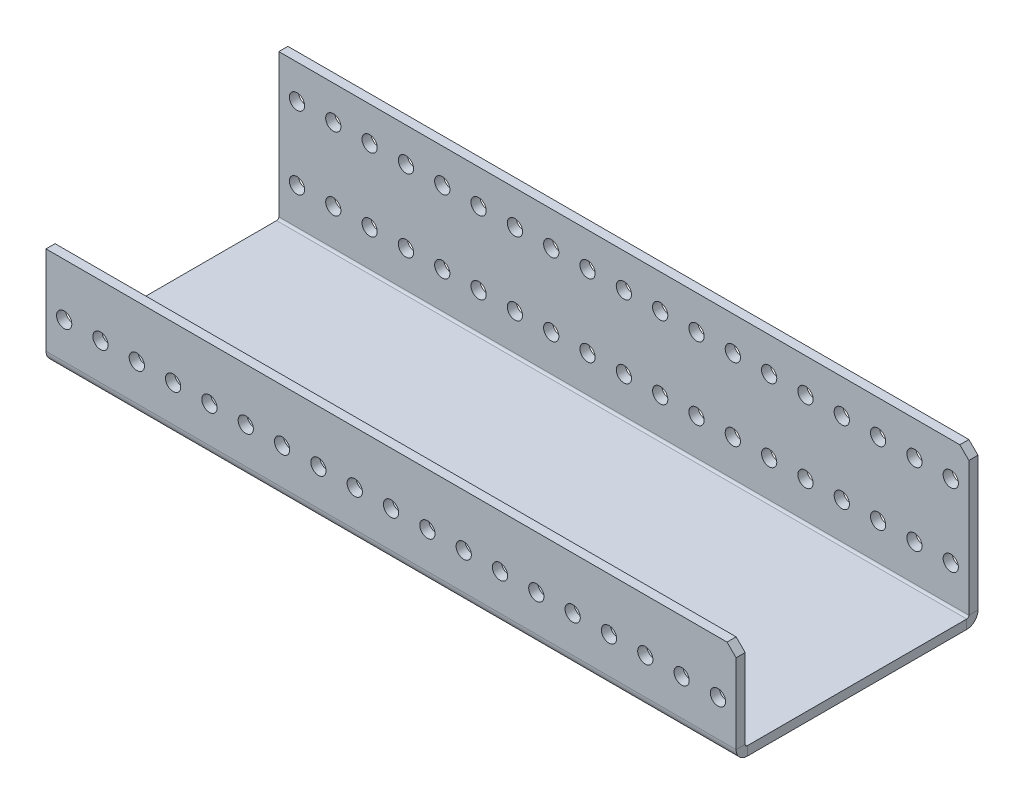
from build123d import *

# Parameters (mm, degrees)
SKETCH1_W                    = 787.4
SKETCH1_H                    = 78.232
BOSS_EXTRUDE1_DEPTH          = 3.175
EDGE_FLANGE1_STRIP_W         = 14.224
EDGE_FLANGE1_STRIP_H         = 3.175
EDGE_FLANGE1_STRIP_CUT_DEPTH = 787.4
EDGE_FLANGE1_DEPTH           = 787.4
EDGE_FLANGE2_STRIP_W         = 14.224
EDGE_FLANGE2_STRIP_H         = 3.175
EDGE_FLANGE2_STRIP_CUT_DEPTH = 787.4
EDGE_FLANGE2_DEPTH           = 787.4
SKETCH9_R                    = 2.667
CUT_EXTRUDE1_DEPTH           = 794.767078776
CHAMFER1_SIZE                = 3.175
LPATTERN1_COUNT              = 62
LPATTERN1_PITCH              = 12.7
SKETCH12_R                   = 1.27
CUT_EXTRUDE4_DEPTH           = 794.225377588
SKETCH14_R                   = 2.667
CUT_EXTRUDE6_DEPTH           = 5.08
LPATTERN4_COUNT              = 62
LPATTERN4_PITCH              = 12.7
SKETCH15_W                   = 546.1
SKETCH15_H                   = 84.582
CUT_EXTRUDE7_DEPTH           = 794.435038471


# Sheet-metal steps are written as plain solids
with BuildPart() as part:
    # Sketch1 → Boss-Extrude1 (new body)
    with BuildSketch(Plane(origin=(0, 0, 0), x_dir=(1, 0, 0), z_dir=(0, 1, 0))):
        with Locations((393.7, 39.116)):
            Rectangle(SKETCH1_W, SKETCH1_H)
    extrude(amount=BOSS_EXTRUDE1_DEPTH)

    # Edge-Flange1 strip (across the edge) → Edge-Flange1 strip cut (cut)
    with BuildSketch(Plane(origin=(787.4, 3.175, -78.232), x_dir=(0, 0, 1), z_dir=(-1, 0, 0))):
        with Locations((-6.35, -1.5875)):
            Rectangle(EDGE_FLANGE1_STRIP_W, EDGE_FLANGE1_STRIP_H)
    extrude(amount=EDGE_FLANGE1_STRIP_CUT_DEPTH, mode=Mode.SUBTRACT)

    # Edge-Flange1 section (across the edge) → Edge-Flange1 (add)
    with BuildSketch(Plane(origin=(787.4, 3.175, -78.232), x_dir=(0, 0, 1), z_dir=(-1, 0, 0))):
        with BuildLine():
            Line((-3.175, 0.762), (-3.175, 50.8))
            Line((-3.175, 50.8), (0, 50.8))
            Line((0, 50.8), (0, 0.762))
            ThreePointArc((0, 0.762), (0.223184633, 0.223184633), (0.762, 0))
            Line((0.762, 0), (0.762, -3.175))
            ThreePointArc((0.762, -3.175), (-2.021879398, -2.021879398), (-3.175, 0.762))
        make_face()
    extrude(amount=EDGE_FLANGE1_DEPTH)

    # Edge-Flange2 strip (across the edge) → Edge-Flange2 strip cut (cut)
    with BuildSketch(Plane(origin=(0, 3.175, 0), x_dir=(0, 0, -1), z_dir=(1, 0, 0))):
        with Locations((-6.35, -1.5875)):
            Rectangle(EDGE_FLANGE2_STRIP_W, EDGE_FLANGE2_STRIP_H)
    extrude(amount=EDGE_FLANGE2_STRIP_CUT_DEPTH, mode=Mode.SUBTRACT)

    # Edge-Flange2 section (across the edge) → Edge-Flange2 (add)
    with BuildSketch(Plane(origin=(0, 3.175, 0), x_dir=(0, 0, -1), z_dir=(1, 0, 0))):
        with BuildLine():
            Line((-3.175, 0.762), (-3.175, 31.75))
            Line((-3.175, 31.75), (0, 31.75))
            Line((0, 31.75), (0, 0.762))
            ThreePointArc((0, 0.762), (0.223184633, 0.223184633), (0.762, 0))
            Line((0.762, 0), (0.762, -3.175))
            ThreePointArc((0.762, -3.175), (-2.021879398, -2.021879398), (-3.175, 0.762))
        make_face()
    extrude(amount=EDGE_FLANGE2_DEPTH)

    # Sketch9 → Cut-Extrude1 (cut, through all)
    with BuildSketch(Plane.XY.offset(3.175)):
        with Locations((781.05, 16.637)):
            Circle(SKETCH9_R)
    cut_extrude1 = extrude(amount=-CUT_EXTRUDE1_DEPTH, mode=Mode.SUBTRACT)

    # Chamfer1
    chamfer1_edges = [part.edges().sort_by_distance(p)[0] for p in [
        (787.4, 53.975, -79.8195),
        (0, 53.975, -79.8195),
        (0, 34.925, 1.5875),
        (787.4, 34.925, 1.5875),
    ]]
    chamfer(chamfer1_edges, length=CHAMFER1_SIZE)

    # LPattern1: Cut-Extrude1 ×62
    with Locations(*[(-i * LPATTERN1_PITCH, 0, 0) for i in range(1, LPATTERN1_COUNT)]):
        add(cut_extrude1, mode=Mode.SUBTRACT)

    # Sketch12 → Cut-Extrude4 (cut, through all)
    with BuildSketch(Plane(origin=(0, 3.175, 0), x_dir=(1, 0, 0), z_dir=(0, 1, 0))):
        with Locations(Location((101.6, 72.39, 0), (0, 0, 270))):
            Circle(SKETCH12_R)
        with Locations(Location((215.9, 72.39, 0), (0, 0, 270))):
            Circle(SKETCH12_R)
        with Locations(Location((215.9, 5.842, 0), (0, 0, 270))):
            Circle(SKETCH12_R)
        with Locations(Location((101.6, 5.842, 0), (0, 0, 270))):
            Circle(SKETCH12_R)
    extrude(amount=-CUT_EXTRUDE4_DEPTH, mode=Mode.SUBTRACT)

    # Sketch14 → Cut-Extrude6 (cut)
    with BuildSketch(Plane(origin=(0, 0, -81.407), x_dir=(-1, 0, 0), z_dir=(0, 0, -1))):
        with Locations(Location((-781.05, 42.037, 0), (0, 0, 90))):
            Circle(SKETCH14_R)
    cut_extrude6 = extrude(amount=-CUT_EXTRUDE6_DEPTH, mode=Mode.SUBTRACT)

    # LPattern4: Cut-Extrude6 ×62
    with Locations(*[(-i * LPATTERN4_PITCH, 0, 0) for i in range(1, LPATTERN4_COUNT)]):
        add(cut_extrude6, mode=Mode.SUBTRACT)

    # Sketch15 → Cut-Extrude7 (cut, through all)
    with BuildSketch(Plane(origin=(0, 53.975, 0), x_dir=(1, 0, 0), z_dir=(0, 1, 0))):
        with Locations((273.05, 39.116)):
            Rectangle(SKETCH15_W, SKETCH15_H)
    extrude(amount=-CUT_EXTRUDE7_DEPTH, mode=Mode.SUBTRACT)


solid = part.part
